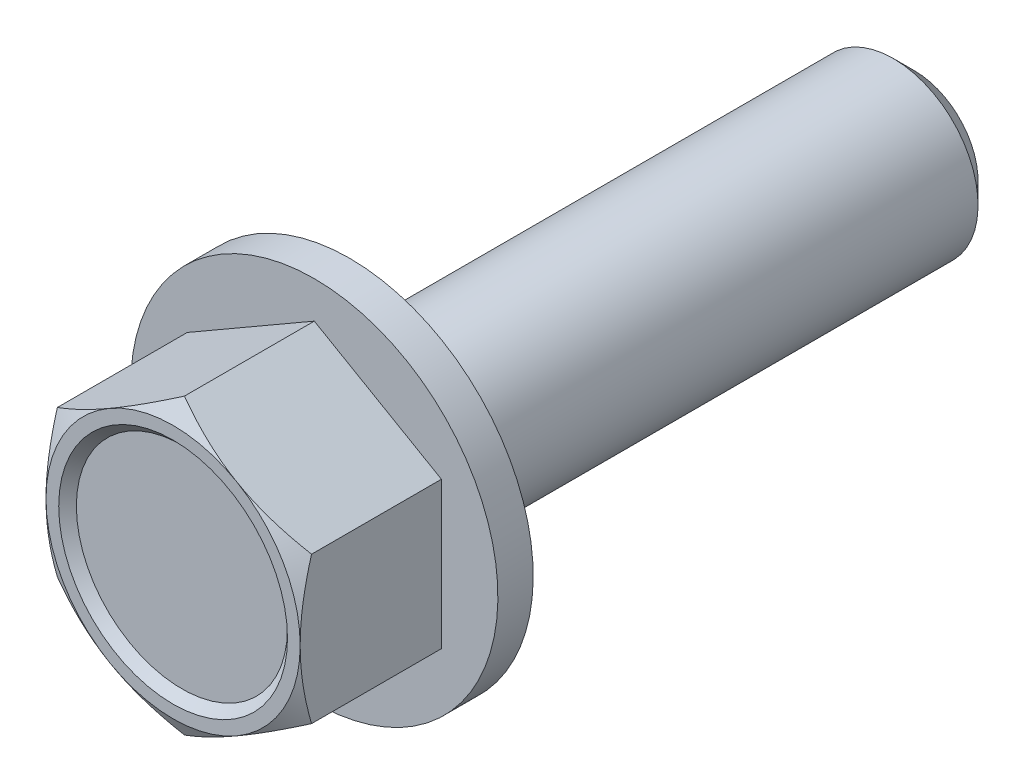
from build123d import *

# Parameters (mm, degrees)
BOSS_EXTRUDE1_DEPTH = 7.9375
SKETCH3_R           = 6.429375
CUT_EXTRUDE1_DEPTH  = 0.49609375
CUT_EXTRUDE1_DRAFT  = -45
CHAMFER1_SIZE       = 1.190625


# Read off the part's stored shape, not the designer's step: Cut-Extrude2
with BuildPart() as part:
    # Sketch1 → Revolve1 (revolve)
    with BuildSketch(Plane(origin=(0, 0, 0), x_dir=(0, 0, -1), z_dir=(1, 0, 0))):
        Polygon((9.921875, 4.7625), (41.671875, 4.7625), (41.671875, 0), (0, 0), (0, 7.14375), (7.9375, 7.14375), (7.9375, 10.31875), (9.921875, 10.31875), align=None)
    revolve(axis=Axis((0, 0, -41.671875), (0, 0, 1)))

    # Sketch2 → Boss-Extrude1 (add)
    with BuildSketch(Plane.XY):
        Polygon((7.14375, 4.124445986), (0, 8.248891971), (-7.14375, 4.124445986), (-7.14375, -4.124445986), (0, -8.248891971), (7.14375, -4.124445986), align=None)
    extrude(amount=-BOSS_EXTRUDE1_DEPTH)

    # Cut-Extrude2 outline → Cut-Extrude2 (revolve, cut)
    with BuildSketch(Plane.XZ):
        Polygon((8.248891975, 1.48e-06), (7.143748081, 1.48e-06), (8.248891975, -0.638054017), align=None)
    revolve(axis=Axis((0, 0, 0), (0, 0, 1)), mode=Mode.SUBTRACT)


with BuildPart() as cut_extrude1_tool:
    # Sketch3 → Cut-Extrude1 (with draft: the straight prism first)
    with BuildSketch(Plane.XY):
        Circle(SKETCH3_R)
    extrude(amount=-CUT_EXTRUDE1_DEPTH)
    # Cut-Extrude1: the draft: its side faces are tilted about the plane it starts from
    cut_extrude1_sides = [cut_extrude1_tool.faces().sort_by_distance(p)[0] for p in [
        (-6.429375, 0, -0.248046875),
    ]]
    draft(cut_extrude1_sides, Plane.XY, CUT_EXTRUDE1_DRAFT)


with BuildPart() as part_1:
    add(part.part)

    # Cut-Extrude1: cut by cut_extrude1_tool
    add(cut_extrude1_tool.part, mode=Mode.SUBTRACT)

    # Chamfer1
    chamfer1_edges = [part_1.edges().sort_by_distance(p)[0] for p in [
        (0, -4.7625, -41.671875),
    ]]
    chamfer(chamfer1_edges, length=CHAMFER1_SIZE)


solid = part_1.part
